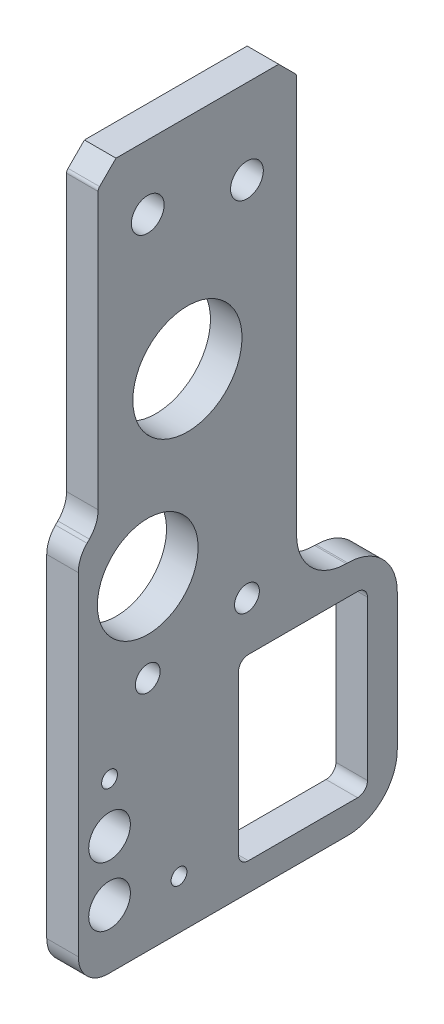
from build123d import *

# Parameters (mm, degrees)
SKETCH1_R             = 5.075
SKETCH1_R_2           = 1.65
SKETCH1_R_3           = 2.1
SKETCH1_R_4           = 0.8
SKETCH1_W             = 13
SKETCH1_H             = 18
BOSS_EXTRUDE1_DEPTH   = 3.18
SKETCH3_R             = 5.5
CUT_EXTRUDE4_DEPTH    = 78.831812262
FILLET2_R             = 3
CHAMFER2_SIZE         = 1.8
FILLET4_R             = 0.5
M2_TAPPED_HOLE1_D     = 1.6
FILLET9_R             = 1
FILLET11_R            = 5
M3X0_5_TAPPED_HOLE1_D = 2.5


with BuildPart() as part:
    # Sketch1 → Boss-Extrude1 (new body)
    with BuildSketch(Plane(origin=(0, 0, 0), x_dir=(0, 0, -1), z_dir=(1, 0, 0))):
        Polygon((0, 0), (0, 37.775), (2, 39.775), (2, 70.81), (22, 70.81), (22, 23.81), (32.15, 23.81), (32.15, 0), align=None)
        with Locations((7, 32.7)):
            Circle(SKETCH1_R, mode=Mode.SUBTRACT)
        with Locations((7, 64.31)):
            Circle(SKETCH1_R_2, mode=Mode.SUBTRACT)
        with Locations((17, 62.31)):
            Circle(SKETCH1_R_2, mode=Mode.SUBTRACT)
        with Locations((3.15, 5.95)):
            Circle(SKETCH1_R_3, mode=Mode.SUBTRACT)
        with Locations((3.15, 11.95)):
            Circle(SKETCH1_R_3, mode=Mode.SUBTRACT)
        with Locations((10.15, 4.95)):
            Circle(SKETCH1_R_4, mode=Mode.SUBTRACT)
        with Locations((3.15, 16.95)):
            Circle(SKETCH1_R_4, mode=Mode.SUBTRACT)
        with Locations((22.65, 11.81)):
            Rectangle(SKETCH1_W, SKETCH1_H, mode=Mode.SUBTRACT)
    extrude(amount=BOSS_EXTRUDE1_DEPTH)

    # Sketch3 → Cut-Extrude4 (cut, through all)
    with BuildSketch(Plane.ZY):
        with Locations((-11, 48.810865899)):
            Circle(SKETCH3_R)
    extrude(amount=-CUT_EXTRUDE4_DEPTH, mode=Mode.SUBTRACT)

    # Fillet2
    fillet2_edges = [part.edges().sort_by_distance(p)[0] for p in [
        (1.59, 37.775, 0),
        (1.59, 39.775, -2),
        (1.59, 0, 0),
    ]]
    fillet(fillet2_edges, radius=FILLET2_R)

    # Chamfer2
    chamfer2_edges = [part.edges().sort_by_distance(p)[0] for p in [
        (1.59, 70.81, -22),
        (1.59, 70.81, -2),
    ]]
    chamfer(chamfer2_edges, length=CHAMFER2_SIZE)

    # Fillet4
    fillet4_edges = [part.edges().sort_by_distance(p)[0] for p in [
        (1.59, 69.01, -2),
        (1.59, 69.01, -22),
    ]]
    fillet(fillet4_edges, radius=FILLET4_R)

    # M2 Tapped Hole1 (through all)
    with Locations(Plane(origin=(0, 16.95, -3.15), x_dir=(0, 0, -1), z_dir=(-1, 0, 0))):
        with Locations((0, 0), (7, 12)):
            Hole(M2_TAPPED_HOLE1_D / 2)

    # Fillet9
    fillet9_edges = [part.edges().sort_by_distance(p)[0] for p in [
        (1.59, 2.81, -29.15),
        (1.59, 2.81, -16.15),
        (1.59, 20.81, -29.15),
        (1.59, 20.81, -16.15),
    ]]
    fillet(fillet9_edges, radius=FILLET9_R)

    # Fillet11
    fillet11_edges = [part.edges().sort_by_distance(p)[0] for p in [
        (1.59, 0, -32.15),
        (1.59, 23.81, -22),
        (1.59, 23.81, -32.15),
    ]]
    fillet(fillet11_edges, radius=FILLET11_R)

    # M3x0.5 Tapped Hole1 (through all)
    with Locations(Plane(origin=(3.18, 0, 0), x_dir=(0, 0, -1), z_dir=(1, 0, 0))):
        with Locations((7, 23.81), (17, 25.81)):
            Hole(M3X0_5_TAPPED_HOLE1_D / 2)


solid = part.part
